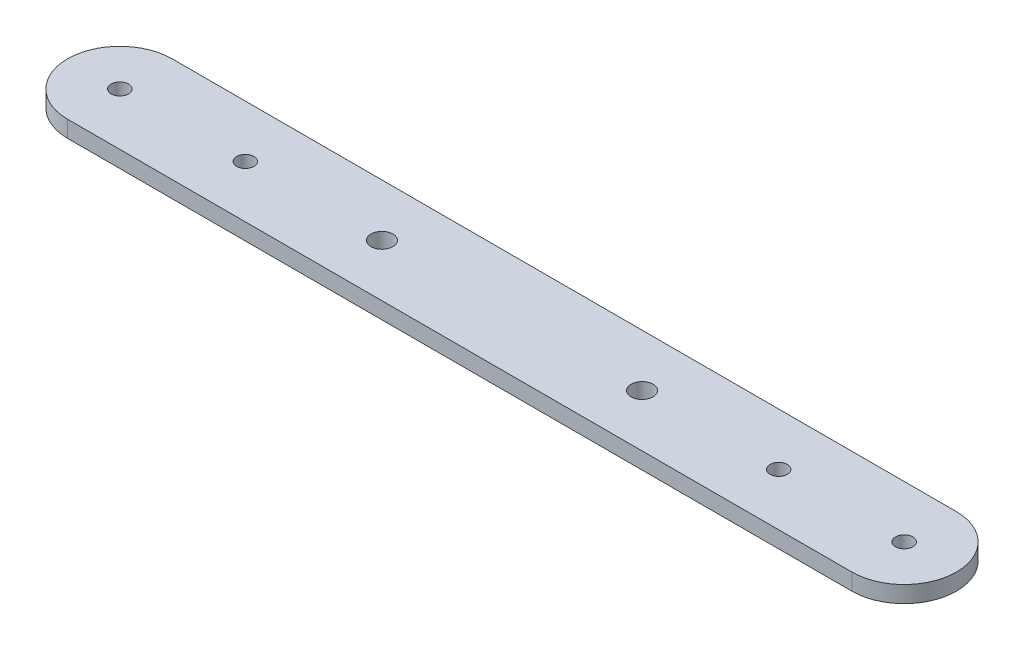
from build123d import *

# Parameters (mm, degrees)
SKETCH1_R           = 1.65
SKETCH1_R_2         = 2.1
BOSS_EXTRUDE1_DEPTH = 3.175


with BuildPart() as part:
    # Sketch1 → Boss-Extrude1 (new body)
    with BuildSketch(Plane(origin=(0, 0, 0), x_dir=(1, 0, 0), z_dir=(0, 1, 0))):
        with BuildLine():
            Line((-75, 7.5), (75, 7.5))
            ThreePointArc((75, 7.5), (85, -2.5), (75, -12.5))
            Line((75, -12.5), (-75, -12.5))
            ThreePointArc((-75, -12.5), (-85, -2.5), (-75, 7.5))
        make_face()
        with Locations((-51, -2.5)):
            Circle(SKETCH1_R, mode=Mode.SUBTRACT)
        with Locations((51, -2.5)):
            Circle(SKETCH1_R, mode=Mode.SUBTRACT)
        with Locations((75, -2.5)):
            Circle(SKETCH1_R, mode=Mode.SUBTRACT)
        with Locations((24.874685928, -2.5)):
            Circle(SKETCH1_R_2, mode=Mode.SUBTRACT)
        with Locations((-24.874685928, -2.5)):
            Circle(SKETCH1_R_2, mode=Mode.SUBTRACT)
        with Locations((-75, -2.5)):
            Circle(SKETCH1_R, mode=Mode.SUBTRACT)
    extrude(amount=BOSS_EXTRUDE1_DEPTH)


solid = part.part
